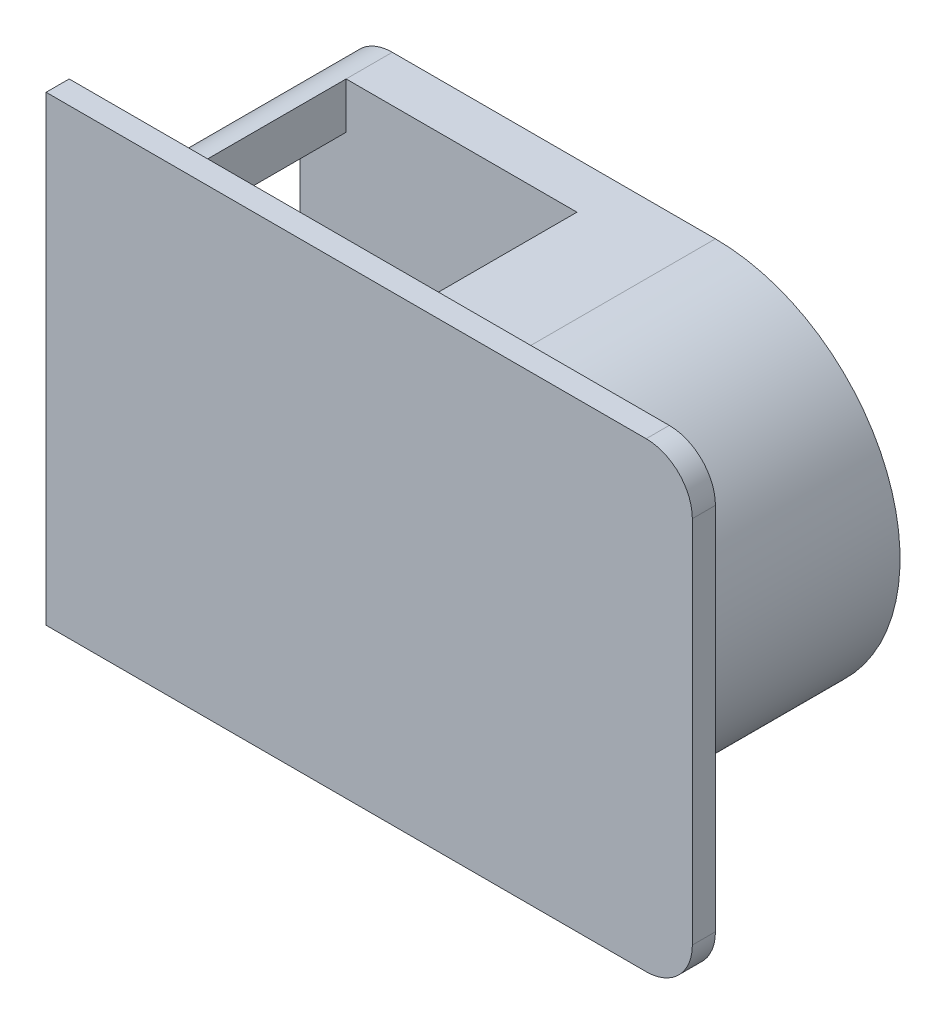
from build123d import *

# Parameters (mm, degrees)
SALIENTE_EXTRUIR2_DEPTH = 50
CROQUIS4_W              = 140
CROQUIS4_H              = 100
SALIENTE_EXTRUIR3_DEPTH = 5
CROQUIS5_R              = 5
CORTAR_EXTRUIR1_DEPTH   = 5
CROQUIS6_W              = 50
CROQUIS6_H              = 40
CORTAR_EXTRUIR2_DEPTH   = 80
CROQUIS7_W              = 40
CROQUIS7_H              = 60
CORTAR_EXTRUIR3_DEPTH   = 50
CROQUIS8_R              = 2.5
CORTAR_EXTRUIR5_DEPTH   = 20
REDONDEO1_R             = 10
REDONDEO2_R             = 10
REDONDEO3_R             = 10
REDONDEO4_R             = 10


with BuildPart() as part:
    # Croquis1 → Saliente-Extruir2 (new body)
    with BuildSketch(Plane.XY):
        with BuildLine():
            Line((-60, 40), (-60, -40))
            Line((-60, -40), (20.000000086, -40))
            ThreePointArc((20.000000086, -40), (60, 8.6e-08), (19.999999914, 40))
            Line((19.999999914, 40), (-60, 40))
        make_face()
    extrude(amount=SALIENTE_EXTRUIR2_DEPTH)

    # Croquis4 → Saliente-Extruir3 (add)
    with BuildSketch(Plane.XY.offset(50)):
        Rectangle(CROQUIS4_W, CROQUIS4_H)
    extrude(amount=SALIENTE_EXTRUIR3_DEPTH)

    # Croquis5 → Cortar-Extruir1 (cut)
    with BuildSketch(Plane(origin=(0, 0, 0), x_dir=(-1, 0, 0), z_dir=(0, 0, -1))):
        with Locations((-20, 0)):
            Circle(CROQUIS5_R)
    extrude(amount=-CORTAR_EXTRUIR1_DEPTH, mode=Mode.SUBTRACT)

    # Croquis6 → Cortar-Extruir2 (cut)
    with BuildSketch(Plane(origin=(0, 40, 0), x_dir=(1, 0, 0), z_dir=(0, 1, 0))):
        with Locations((-25, -30)):
            Rectangle(CROQUIS6_W, CROQUIS6_H)
    extrude(amount=-CORTAR_EXTRUIR2_DEPTH, mode=Mode.SUBTRACT)

    # Croquis7 → Cortar-Extruir3 (cut)
    with BuildSketch(Plane.ZY.offset(60)):
        with Locations((30, 0)):
            Rectangle(CROQUIS7_W, CROQUIS7_H)
    extrude(amount=-CORTAR_EXTRUIR3_DEPTH, mode=Mode.SUBTRACT)

    # Croquis8 → Cortar-Extruir5 (cut)
    with BuildSketch(Plane(origin=(0, 0, 0), x_dir=(-1, 0, 0), z_dir=(0, 0, -1))):
        with Locations((30, 0)):
            Circle(CROQUIS8_R)
    extrude(amount=-CORTAR_EXTRUIR5_DEPTH, mode=Mode.SUBTRACT)

    # Redondeo1
    redondeo1_edges = [part.edges().sort_by_distance(p)[0] for p in [
        (70, -50, 52.5),
    ]]
    fillet(redondeo1_edges, radius=REDONDEO1_R)

    # Redondeo2
    redondeo2_edges = [part.edges().sort_by_distance(p)[0] for p in [
        (70, 50, 52.5),
    ]]
    fillet(redondeo2_edges, radius=REDONDEO2_R)

    # Redondeo3
    redondeo3_edges = [part.edges().sort_by_distance(p)[0] for p in [
        (-60, -40, 25),
    ]]
    fillet(redondeo3_edges, radius=REDONDEO3_R)

    # Redondeo4
    redondeo4_edges = [part.edges().sort_by_distance(p)[0] for p in [
        (-60, 40, 25),
    ]]
    fillet(redondeo4_edges, radius=REDONDEO4_R - 0.0001)  # a hair under: the kernel refuses the full size


solid = part.part
